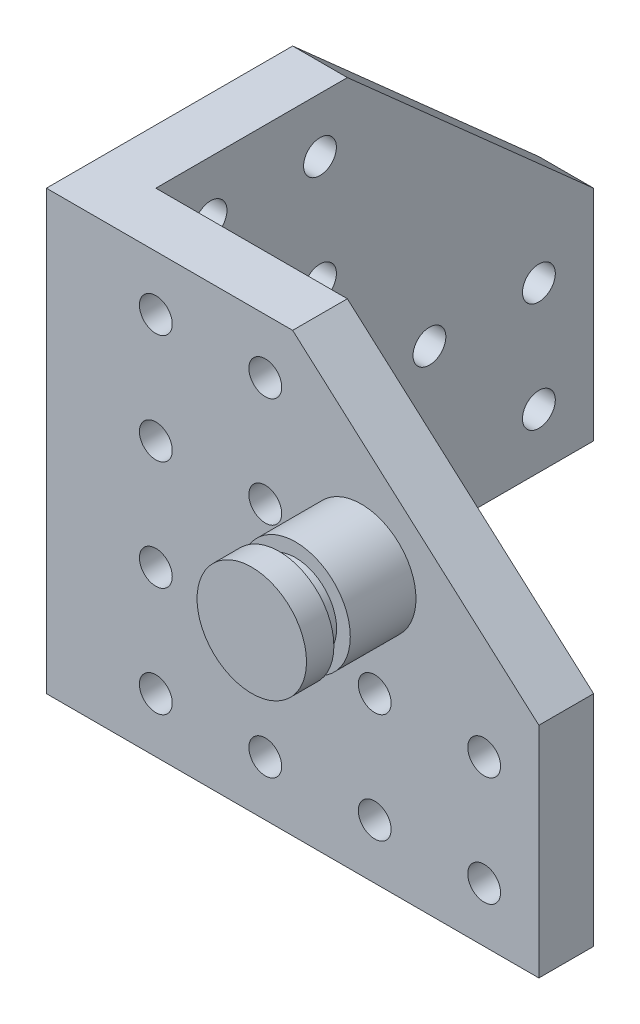
from build123d import *

# Parameters (mm, degrees)
BOSS_EXTRUDE1_DEPTH = 80
CUT_EXTRUDE1_REACH  = 152.333
CUT_EXTRUDE2_REACH  = 152.333
CUT_EXTRUDE3_REACH  = 152.333
SKETCH4_R           = 3
CUT_EXTRUDE4_REACH  = 152.333
SKETCH5_R           = 2.5
SKETCH5_R_2         = 3
SKETCH6_R           = 10
BOSS_EXTRUDE2_DEPTH = 20
CUT_EXTRUDE5_START  = -8
SKETCH7_R           = 10
SKETCH7_R_2         = 7.5
CUT_EXTRUDE5_DEPTH  = 3
SKETCH8_R           = 10
BOSS_EXTRUDE3_DEPTH = 20
CUT_EXTRUDE6_START  = -8
SKETCH9_R           = 10
SKETCH9_R_2         = 7.5
CUT_EXTRUDE6_DEPTH  = 3


with BuildPart() as part:
    # Sketch1 → Boss-Extrude1 (new body)
    with BuildSketch(Plane(origin=(0, 0, 0), x_dir=(1, 0, 0), z_dir=(0, 1, 0))):
        Polygon((0, 0), (90, 0), (90, 10), (10, 10), (10, 90), (0, 90), align=None)
    extrude(amount=BOSS_EXTRUDE1_DEPTH)

    # Sketch2 → Cut-Extrude1 (cut, up to next)
    with BuildSketch(Plane.XY, mode=Mode.PRIVATE) as cut_extrude1_sk1:
        Polygon((45, 80), (90, 40), (90, 80), align=None)
    cut_extrude1_tool1 = extrude(cut_extrude1_sk1.sketch, amount=-CUT_EXTRUDE1_REACH, mode=Mode.PRIVATE) & part.part
    add(cut_extrude1_tool1.solids().sort_by_distance((75, 66.666667, 0))[0], mode=Mode.SUBTRACT)

    # Sketch3 → Cut-Extrude2 (cut, up to next)
    with BuildSketch(Plane.ZY, mode=Mode.PRIVATE) as cut_extrude2_sk1:
        Polygon((-45, 80), (-90, 40), (-90, 80), align=None)
    cut_extrude2_tool1 = extrude(cut_extrude2_sk1.sketch, amount=-CUT_EXTRUDE2_REACH, mode=Mode.PRIVATE) & part.part
    add(cut_extrude2_tool1.solids().sort_by_distance((0, 66.666667, -75))[0], mode=Mode.SUBTRACT)

    # Sketch4 → Cut-Extrude3 (cut, up to next)
    with BuildSketch(Plane.XY, mode=Mode.PRIVATE) as cut_extrude3_sk1:
        with Locations((20, 70)):
            Circle(SKETCH4_R)
    cut_extrude3_tool1 = extrude(cut_extrude3_sk1.sketch, amount=-CUT_EXTRUDE3_REACH, mode=Mode.PRIVATE) & part.part
    # Sketch4 → Cut-Extrude3 (cut, up to next)
    with BuildSketch(Plane.XY, mode=Mode.PRIVATE) as cut_extrude3_sk2:
        with Locations((40, 70)):
            Circle(SKETCH4_R)
    cut_extrude3_tool2 = extrude(cut_extrude3_sk2.sketch, amount=-CUT_EXTRUDE3_REACH, mode=Mode.PRIVATE) & part.part
    # Sketch4 → Cut-Extrude3 (cut, up to next)
    with BuildSketch(Plane.XY, mode=Mode.PRIVATE) as cut_extrude3_sk3:
        with Locations((40, 50)):
            Circle(SKETCH4_R)
    cut_extrude3_tool3 = extrude(cut_extrude3_sk3.sketch, amount=-CUT_EXTRUDE3_REACH, mode=Mode.PRIVATE) & part.part
    # Sketch4 → Cut-Extrude3 (cut, up to next)
    with BuildSketch(Plane.XY, mode=Mode.PRIVATE) as cut_extrude3_sk4:
        with Locations((20, 30)):
            Circle(SKETCH4_R)
    cut_extrude3_tool4 = extrude(cut_extrude3_sk4.sketch, amount=-CUT_EXTRUDE3_REACH, mode=Mode.PRIVATE) & part.part
    # Sketch4 → Cut-Extrude3 (cut, up to next)
    with BuildSketch(Plane.XY, mode=Mode.PRIVATE) as cut_extrude3_sk5:
        with Locations((40, 10)):
            Circle(SKETCH4_R)
    cut_extrude3_tool5 = extrude(cut_extrude3_sk5.sketch, amount=-CUT_EXTRUDE3_REACH, mode=Mode.PRIVATE) & part.part
    # Sketch4 → Cut-Extrude3 (cut, up to next)
    with BuildSketch(Plane.XY, mode=Mode.PRIVATE) as cut_extrude3_sk6:
        with Locations((20, 50)):
            Circle(SKETCH4_R)
    cut_extrude3_tool6 = extrude(cut_extrude3_sk6.sketch, amount=-CUT_EXTRUDE3_REACH, mode=Mode.PRIVATE) & part.part
    # Sketch4 → Cut-Extrude3 (cut, up to next)
    with BuildSketch(Plane.XY, mode=Mode.PRIVATE) as cut_extrude3_sk7:
        with Locations((40, 30)):
            Circle(SKETCH4_R)
    cut_extrude3_tool7 = extrude(cut_extrude3_sk7.sketch, amount=-CUT_EXTRUDE3_REACH, mode=Mode.PRIVATE) & part.part
    # Sketch4 → Cut-Extrude3 (cut, up to next)
    with BuildSketch(Plane.XY, mode=Mode.PRIVATE) as cut_extrude3_sk8:
        with Locations((20, 10)):
            Circle(SKETCH4_R)
    cut_extrude3_tool8 = extrude(cut_extrude3_sk8.sketch, amount=-CUT_EXTRUDE3_REACH, mode=Mode.PRIVATE) & part.part
    # Sketch4 → Cut-Extrude3 (cut, up to next)
    with BuildSketch(Plane.XY, mode=Mode.PRIVATE) as cut_extrude3_sk9:
        with Locations((60, 30)):
            Circle(SKETCH4_R)
    cut_extrude3_tool9 = extrude(cut_extrude3_sk9.sketch, amount=-CUT_EXTRUDE3_REACH, mode=Mode.PRIVATE) & part.part
    # Sketch4 → Cut-Extrude3 (cut, up to next)
    with BuildSketch(Plane.XY, mode=Mode.PRIVATE) as cut_extrude3_sk10:
        with Locations((80, 10)):
            Circle(SKETCH4_R)
    cut_extrude3_tool10 = extrude(cut_extrude3_sk10.sketch, amount=-CUT_EXTRUDE3_REACH, mode=Mode.PRIVATE) & part.part
    # Sketch4 → Cut-Extrude3 (cut, up to next)
    with BuildSketch(Plane.XY, mode=Mode.PRIVATE) as cut_extrude3_sk11:
        with Locations((80, 30)):
            Circle(SKETCH4_R)
    cut_extrude3_tool11 = extrude(cut_extrude3_sk11.sketch, amount=-CUT_EXTRUDE3_REACH, mode=Mode.PRIVATE) & part.part
    # Sketch4 → Cut-Extrude3 (cut, up to next)
    with BuildSketch(Plane.XY, mode=Mode.PRIVATE) as cut_extrude3_sk12:
        with Locations((60, 10)):
            Circle(SKETCH4_R)
    cut_extrude3_tool12 = extrude(cut_extrude3_sk12.sketch, amount=-CUT_EXTRUDE3_REACH, mode=Mode.PRIVATE) & part.part
    add(cut_extrude3_tool1.solids().sort_by_distance((20, 70, 0))[0], mode=Mode.SUBTRACT)
    add(cut_extrude3_tool2.solids().sort_by_distance((40, 70, 0))[0], mode=Mode.SUBTRACT)
    add(cut_extrude3_tool3.solids().sort_by_distance((40, 50, 0))[0], mode=Mode.SUBTRACT)
    add(cut_extrude3_tool4.solids().sort_by_distance((20, 30, 0))[0], mode=Mode.SUBTRACT)
    add(cut_extrude3_tool5.solids().sort_by_distance((40, 10, 0))[0], mode=Mode.SUBTRACT)
    add(cut_extrude3_tool6.solids().sort_by_distance((20, 50, 0))[0], mode=Mode.SUBTRACT)
    add(cut_extrude3_tool7.solids().sort_by_distance((40, 30, 0))[0], mode=Mode.SUBTRACT)
    add(cut_extrude3_tool8.solids().sort_by_distance((20, 10, 0))[0], mode=Mode.SUBTRACT)
    add(cut_extrude3_tool9.solids().sort_by_distance((60, 30, 0))[0], mode=Mode.SUBTRACT)
    add(cut_extrude3_tool10.solids().sort_by_distance((80, 10, 0))[0], mode=Mode.SUBTRACT)
    add(cut_extrude3_tool11.solids().sort_by_distance((80, 30, 0))[0], mode=Mode.SUBTRACT)
    add(cut_extrude3_tool12.solids().sort_by_distance((60, 10, 0))[0], mode=Mode.SUBTRACT)

    # Sketch5 → Cut-Extrude4 (cut, up to next)
    with BuildSketch(Plane.ZY, mode=Mode.PRIVATE) as cut_extrude4_sk1:
        with Locations((-20, 30)):
            Circle(SKETCH5_R)
    cut_extrude4_tool1 = extrude(cut_extrude4_sk1.sketch, amount=-CUT_EXTRUDE4_REACH, mode=Mode.PRIVATE) & part.part
    # Sketch5 → Cut-Extrude4 (cut, up to next)
    with BuildSketch(Plane.ZY, mode=Mode.PRIVATE) as cut_extrude4_sk2:
        with Locations((-40, 30)):
            Circle(SKETCH5_R)
    cut_extrude4_tool2 = extrude(cut_extrude4_sk2.sketch, amount=-CUT_EXTRUDE4_REACH, mode=Mode.PRIVATE) & part.part
    # Sketch5 → Cut-Extrude4 (cut, up to next)
    with BuildSketch(Plane.ZY, mode=Mode.PRIVATE) as cut_extrude4_sk3:
        with Locations((-40, 10)):
            Circle(SKETCH5_R)
    cut_extrude4_tool3 = extrude(cut_extrude4_sk3.sketch, amount=-CUT_EXTRUDE4_REACH, mode=Mode.PRIVATE) & part.part
    # Sketch5 → Cut-Extrude4 (cut, up to next)
    with BuildSketch(Plane.ZY, mode=Mode.PRIVATE) as cut_extrude4_sk4:
        with Locations((-20, 10)):
            Circle(SKETCH5_R)
    cut_extrude4_tool4 = extrude(cut_extrude4_sk4.sketch, amount=-CUT_EXTRUDE4_REACH, mode=Mode.PRIVATE) & part.part
    # Sketch5 → Cut-Extrude4 (cut, up to next)
    with BuildSketch(Plane.ZY, mode=Mode.PRIVATE) as cut_extrude4_sk5:
        with Locations((-20, 70)):
            Circle(SKETCH5_R_2)
    cut_extrude4_tool5 = extrude(cut_extrude4_sk5.sketch, amount=-CUT_EXTRUDE4_REACH, mode=Mode.PRIVATE) & part.part
    # Sketch5 → Cut-Extrude4 (cut, up to next)
    with BuildSketch(Plane.ZY, mode=Mode.PRIVATE) as cut_extrude4_sk6:
        with Locations((-40, 70)):
            Circle(SKETCH5_R_2)
    cut_extrude4_tool6 = extrude(cut_extrude4_sk6.sketch, amount=-CUT_EXTRUDE4_REACH, mode=Mode.PRIVATE) & part.part
    # Sketch5 → Cut-Extrude4 (cut, up to next)
    with BuildSketch(Plane.ZY, mode=Mode.PRIVATE) as cut_extrude4_sk7:
        with Locations((-40, 50)):
            Circle(SKETCH5_R_2)
    cut_extrude4_tool7 = extrude(cut_extrude4_sk7.sketch, amount=-CUT_EXTRUDE4_REACH, mode=Mode.PRIVATE) & part.part
    # Sketch5 → Cut-Extrude4 (cut, up to next)
    with BuildSketch(Plane.ZY, mode=Mode.PRIVATE) as cut_extrude4_sk8:
        with Locations((-20, 50)):
            Circle(SKETCH5_R_2)
    cut_extrude4_tool8 = extrude(cut_extrude4_sk8.sketch, amount=-CUT_EXTRUDE4_REACH, mode=Mode.PRIVATE) & part.part
    # Sketch5 → Cut-Extrude4 (cut, up to next)
    with BuildSketch(Plane.ZY, mode=Mode.PRIVATE) as cut_extrude4_sk9:
        with Locations((-60, 30)):
            Circle(SKETCH5_R_2)
    cut_extrude4_tool9 = extrude(cut_extrude4_sk9.sketch, amount=-CUT_EXTRUDE4_REACH, mode=Mode.PRIVATE) & part.part
    # Sketch5 → Cut-Extrude4 (cut, up to next)
    with BuildSketch(Plane.ZY, mode=Mode.PRIVATE) as cut_extrude4_sk10:
        with Locations((-80, 30)):
            Circle(SKETCH5_R_2)
    cut_extrude4_tool10 = extrude(cut_extrude4_sk10.sketch, amount=-CUT_EXTRUDE4_REACH, mode=Mode.PRIVATE) & part.part
    # Sketch5 → Cut-Extrude4 (cut, up to next)
    with BuildSketch(Plane.ZY, mode=Mode.PRIVATE) as cut_extrude4_sk11:
        with Locations((-80, 10)):
            Circle(SKETCH5_R_2)
    cut_extrude4_tool11 = extrude(cut_extrude4_sk11.sketch, amount=-CUT_EXTRUDE4_REACH, mode=Mode.PRIVATE) & part.part
    # Sketch5 → Cut-Extrude4 (cut, up to next)
    with BuildSketch(Plane.ZY, mode=Mode.PRIVATE) as cut_extrude4_sk12:
        with Locations((-60, 10)):
            Circle(SKETCH5_R_2)
    cut_extrude4_tool12 = extrude(cut_extrude4_sk12.sketch, amount=-CUT_EXTRUDE4_REACH, mode=Mode.PRIVATE) & part.part
    add(cut_extrude4_tool1.solids().sort_by_distance((0, 30, -20))[0], mode=Mode.SUBTRACT)
    add(cut_extrude4_tool2.solids().sort_by_distance((0, 30, -40))[0], mode=Mode.SUBTRACT)
    add(cut_extrude4_tool3.solids().sort_by_distance((0, 10, -40))[0], mode=Mode.SUBTRACT)
    add(cut_extrude4_tool4.solids().sort_by_distance((0, 10, -20))[0], mode=Mode.SUBTRACT)
    add(cut_extrude4_tool5.solids().sort_by_distance((0, 70, -20))[0], mode=Mode.SUBTRACT)
    add(cut_extrude4_tool6.solids().sort_by_distance((0, 70, -40))[0], mode=Mode.SUBTRACT)
    add(cut_extrude4_tool7.solids().sort_by_distance((0, 50, -40))[0], mode=Mode.SUBTRACT)
    add(cut_extrude4_tool8.solids().sort_by_distance((0, 50, -20))[0], mode=Mode.SUBTRACT)
    add(cut_extrude4_tool9.solids().sort_by_distance((0, 30, -60))[0], mode=Mode.SUBTRACT)
    add(cut_extrude4_tool10.solids().sort_by_distance((0, 30, -80))[0], mode=Mode.SUBTRACT)
    add(cut_extrude4_tool11.solids().sort_by_distance((0, 10, -80))[0], mode=Mode.SUBTRACT)
    add(cut_extrude4_tool12.solids().sort_by_distance((0, 10, -60))[0], mode=Mode.SUBTRACT)

    # Sketch6 → Boss-Extrude2 (add)
    with BuildSketch(Plane.ZY):
        with Locations((-57.534542418, 48.78886022)):
            Circle(SKETCH6_R)
    extrude(amount=BOSS_EXTRUDE2_DEPTH)

    # Sketch7 → Cut-Extrude5 (cut)
    with BuildSketch(Plane.ZY.offset(20).offset(CUT_EXTRUDE5_START)):
        with Locations((-57.534542418, 48.78886022)):
            Circle(SKETCH7_R)
        with Locations((-57.534542418, 48.78886022)):
            Circle(SKETCH7_R_2, mode=Mode.SUBTRACT)
    extrude(amount=CUT_EXTRUDE5_DEPTH, mode=Mode.SUBTRACT)

    # Sketch8 → Boss-Extrude3 (add)
    with BuildSketch(Plane.XY):
        with Locations((57.534542418, 48.78886022)):
            Circle(SKETCH8_R)
    extrude(amount=BOSS_EXTRUDE3_DEPTH)

    # Sketch9 → Cut-Extrude6 (cut)
    with BuildSketch(Plane.XY.offset(20).offset(CUT_EXTRUDE6_START)):
        with Locations((57.534542418, 48.78886022)):
            Circle(SKETCH9_R)
        with Locations((57.534542418, 48.78886022)):
            Circle(SKETCH9_R_2, mode=Mode.SUBTRACT)
    extrude(amount=CUT_EXTRUDE6_DEPTH, mode=Mode.SUBTRACT)


solid = part.part
